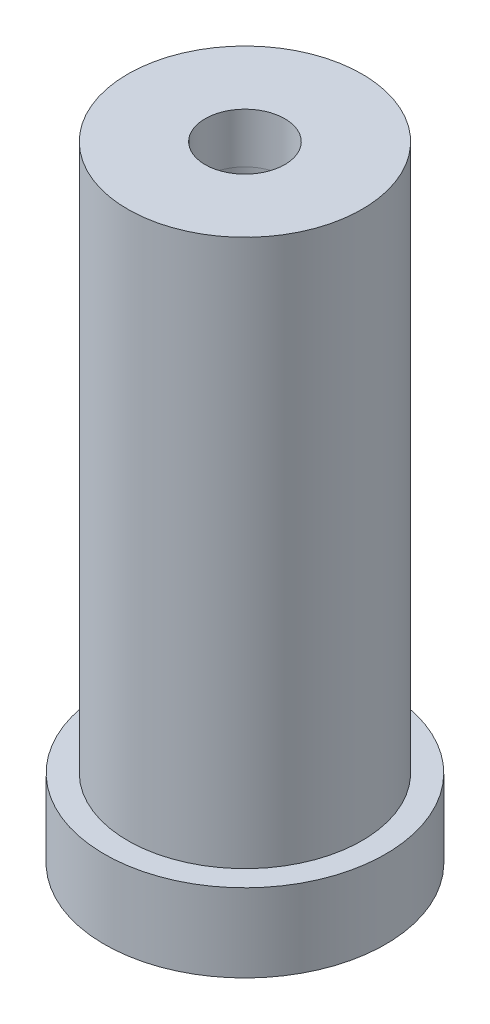
from build123d import *

# Parameters (mm, degrees)
CUT_EXTRUDE1_REACH = 43.976
SKETCH2_R          = 2.55


with BuildPart() as part:
    # Sketch1 → Revolve1 (revolve)
    with BuildSketch(Plane.XY):
        Polygon((0, 0), (9, 0), (9, 5), (7.5, 5), (7.5, 40), (0, 40), align=None)
    revolve(axis=Axis((0, 45, 0), (0, -1, 0)))

    # Sketch2 → Cut-Extrude1 (cut, up to next)
    with BuildSketch(Plane(origin=(0, 40, 0), x_dir=(1, 0, 0), z_dir=(0, 1, 0)), mode=Mode.PRIVATE) as cut_extrude1_sk1:
        Circle(SKETCH2_R)
    cut_extrude1_tool1 = extrude(cut_extrude1_sk1.sketch, amount=-CUT_EXTRUDE1_REACH, mode=Mode.PRIVATE) & part.part
    add(cut_extrude1_tool1.solids().sort_by_distance((0, 40, 0))[0], mode=Mode.SUBTRACT)

    # Cut-Sweep1: sweep along a path in Sketch5
    with BuildLine(Plane(origin=(0, 40, 0), x_dir=(1, 0, 0), z_dir=(0, 1, 0))) as cut_sweep1_path:
        CenterArc((0, 0), 2.55, 0, 360)
    # Sketch3 → Cut-Sweep1 (sweep, cut)
    with BuildSketch(Plane.XY):
        Polygon((2.55, 36.8), (3.513641914, 0), (2.55, 0), align=None)
    sweep(path=cut_sweep1_path.line, mode=Mode.SUBTRACT)


solid = part.part
